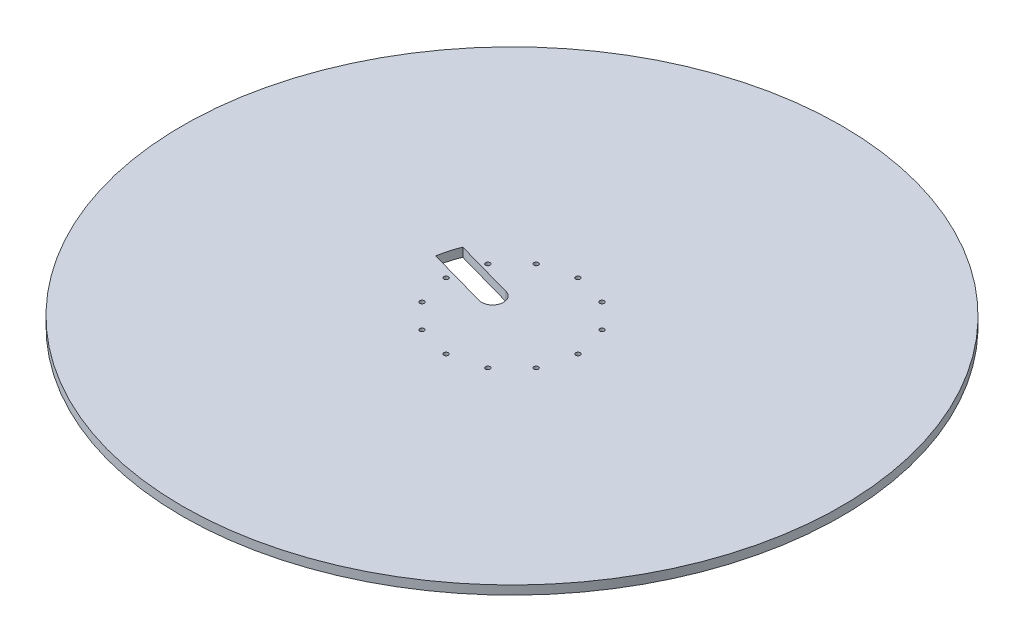
from build123d import *

# Parameters (mm, degrees)
SKETCH1_R           = 300
SKETCH1_R_2         = 2.05
BOSS_EXTRUDE1_DEPTH = 8
CUT_EXTRUDE1_DEPTH  = 425.339486732
FILLET1_R           = 10


with BuildPart() as part:
    # Sketch1 → Boss-Extrude1 (new body)
    with BuildSketch(Plane(origin=(0, 0, 0), x_dir=(1, 0, 0), z_dir=(0, 1, 0))):
        with Locations(Location((0, 0, 0), (0, 0, 270))):
            Circle(SKETCH1_R)
        with Locations(Location((0, 60, 0), (0, 0, 270))):
            Circle(SKETCH1_R_2, mode=Mode.SUBTRACT)
        with Locations(Location((30, 51.961524227, 0), (0, 0, 270))):
            Circle(SKETCH1_R_2, mode=Mode.SUBTRACT)
        with Locations(Location((51.961524227, 30, 0), (0, 0, 270))):
            Circle(SKETCH1_R_2, mode=Mode.SUBTRACT)
        with Locations(Location((60, 0, 0), (0, 0, 270))):
            Circle(SKETCH1_R_2, mode=Mode.SUBTRACT)
        with Locations(Location((51.961524227, -30, 0), (0, 0, 270))):
            Circle(SKETCH1_R_2, mode=Mode.SUBTRACT)
        with Locations(Location((30, -51.961524227, 0), (0, 0, 270))):
            Circle(SKETCH1_R_2, mode=Mode.SUBTRACT)
        with Locations(Location((0, -60, 0), (0, 0, 270))):
            Circle(SKETCH1_R_2, mode=Mode.SUBTRACT)
        with Locations(Location((-30, -51.961524227, 0), (0, 0, 270))):
            Circle(SKETCH1_R_2, mode=Mode.SUBTRACT)
        with Locations(Location((-51.961524227, -30, 0), (0, 0, 270))):
            Circle(SKETCH1_R_2, mode=Mode.SUBTRACT)
        with Locations(Location((-60, 0, 0), (0, 0, 270))):
            Circle(SKETCH1_R_2, mode=Mode.SUBTRACT)
        with Locations(Location((-51.961524227, 30, 0), (0, 0, 270))):
            Circle(SKETCH1_R_2, mode=Mode.SUBTRACT)
        with Locations(Location((-30, 51.961524227, 0), (0, 0, 270))):
            Circle(SKETCH1_R_2, mode=Mode.SUBTRACT)
    extrude(amount=BOSS_EXTRUDE1_DEPTH)

    # Sketch2 → Cut-Extrude1 (cut, through all)
    with BuildSketch(Plane(origin=(0, 8, 0), x_dir=(1, 0, 0), z_dir=(0, 1, 0))):
        with BuildLine():
            Line((-17.622435747, -5.449748467), (-82.039644988, 12.589545274))
            ThreePointArc((-82.039644988, 12.589545274), (-79.925216211, 22.38213157), (-76.646360273, 31.848633518))
            Line((-76.646360273, 31.848633518), (-12.229151031, 13.809339776))
            Line((-12.229151031, 13.809339776), (-17.622435747, -5.449748467))
        make_face()
    extrude(amount=-CUT_EXTRUDE1_DEPTH, mode=Mode.SUBTRACT)

    # Fillet1
    fillet1_edges = [part.edges().sort_by_distance(p)[0] for p in [
        (-17.622435747, 4, 5.449748467),
        (-12.229151031, 4, -13.809339776),
    ]]
    fillet(fillet1_edges, radius=FILLET1_R - 0.0001)  # a hair under: the kernel refuses the full size


solid = part.part
